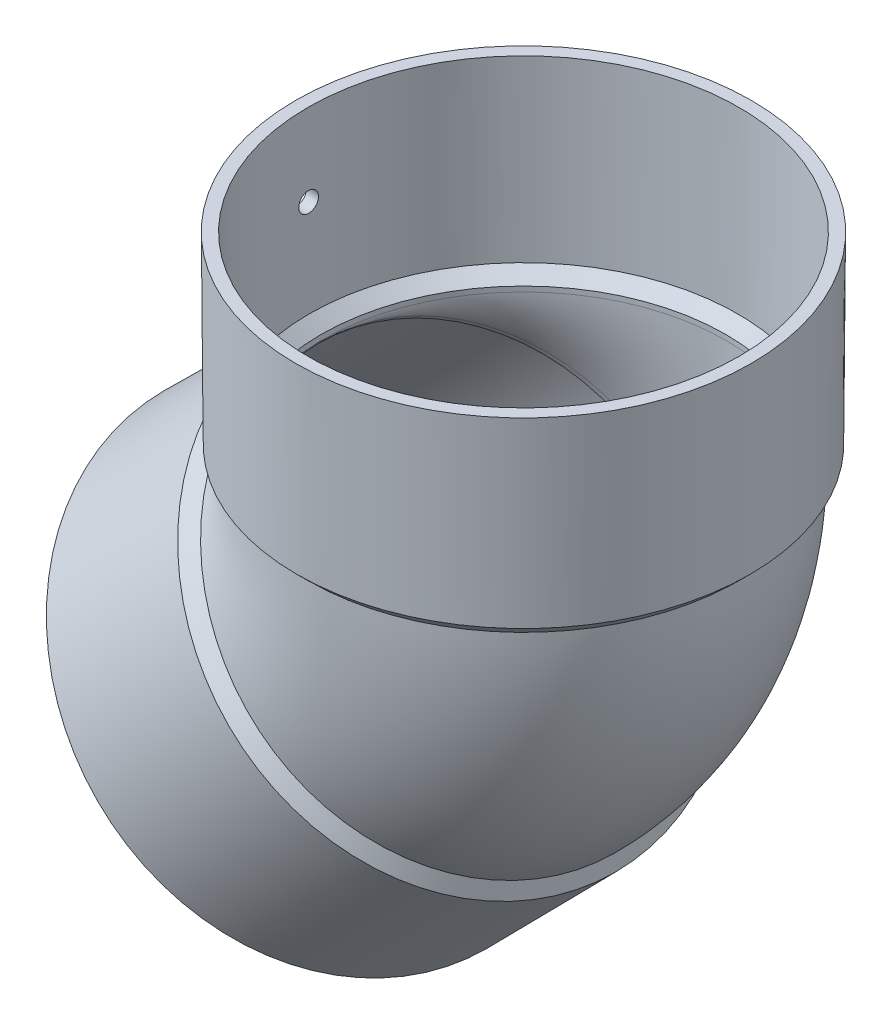
from build123d import *

# Parameters (mm, degrees)
SWEEP1_OUTLINE_R                 = 50.4825
SWEEP1_ANGLE                     = 45
F_10_0_1935_DIAMETER_HOLE1_D     = 4.9149
F_10_0_1935_DIAMETER_HOLE1_DEPTH = 76.2
F_10_0_1935_DIAMETER_HOLE1_TIP   = 1.476584928


# Read off the part's stored shape, not the designer's step: Sweep1
with BuildPart() as part:
    # Sketch1 → Revolve1 (revolve)
    with BuildSketch(Plane.XY):
        Polygon((-11.360023993, -87.422793339), (-9.204762524, -89.578054808), (22.903305281, -57.008000415), (22.873463107, -52.830095994), (20.718201637, -50.674834525), (19.81643184, -51.576604322), (19.846366028, -55.767390512), align=None)
    revolve(axis=Axis((-49.391408666, -49.391408666, 0), (0.707106781186549, 0.707106781186546, 0)))

    # Sketch2 → Revolve2 (revolve)
    with BuildSketch(Plane(origin=(0, 0, 0), x_dir=(-1, 0, 0), z_dir=(0, 0, -1)), mode=Mode.PRIVATE) as revolve2_sk:
        Polygon((-56.505826151, 24.1156612), (-53.5305, 21.182538256), (-50.4825, 21.182538256), (-50.4825, 22.457833333), (-53.467, 25.4), (-53.7845, 69.85), (-56.8325, 69.85), align=None)
    revolve(revolve2_sk.sketch.rotate(Axis((0, 69.85, 0), (0, -1, 0)), 180), axis=Axis((0, 69.85, 0), (0, -1, 0)))

    # Sweep1 outline → Sweep1 (revolve)
    with BuildSketch(Plane(origin=(-51.139171144, 21.182538256, 0), x_dir=(0.7071067811865458, -0.7071067811865492, 0), z_dir=(-0.7071067811865492, -0.7071067811865458, 0))):
        with BuildLine():
            add(Edge.make_bspline(
                [(0, -15.820859805), (3.386630847, -26.767767661), (10.25130148, -38.496554105), (21.767653092, -48.823978651), (37.04613395, -53.530499997), (58.423945129, -53.530500001), (65.508765494, -52.291102822), (71.965878454, -49.951324198), (77.591040871, -46.913712001), (89.454406147, -38.379551501), (96.226005165, -31.333524518), (101.848697911, -22.017553206), (107.472700853, 3.04e-07), (101.848697636, 22.017553663), (96.226004942, 31.333524749), (89.454406032, 38.379551584), (77.591040819, 46.913712039), (71.965878332, 49.951324264), (65.508765283, 52.291102899), (58.42394482, 53.530500055), (37.046133615, 53.530499893), (21.767652893, 48.823978477), (10.2513014, 38.496553967), (3.386630828, 26.767767599), (0, 15.820859805)],
                knots=[7.875906621, 7.875906621, 7.875906621, 7.875906621, 7.875906621, 7.875906621, 9.124748328, 9.124748328, 9.124748328, 9.124748328, 9.770281969, 9.770281969, 9.770281969, 9.770281969, 10.71746965, 10.71746965, 10.71746965, 11.664657316, 11.664657316, 11.664657316, 11.664657316, 12.310190963, 12.310190963, 12.310190963, 12.310190963, 13.559032663, 13.559032663, 13.559032663, 13.559032663, 13.559032663, 13.559032663], degree=5, weights=[1, 1, 0.991757982, 0.985412067, 1, 1, 0.999839694, 1.000222797, 1, 1, 0.999082466, 0.99680945, 1.00319055, 0.99680945, 0.999082467, 1, 1, 1.000222797, 0.999839694, 1, 1, 0.985412067, 0.991757982, 1, 1]))
            Line((0, 15.820859805), (0, -15.820859805))
        make_face()
        with Locations((51.139171144, 0)):
            Circle(SWEEP1_OUTLINE_R, mode=Mode.SUBTRACT)
    revolve(axis=Axis((-51.139171144, 21.182538256, 0), (0, 0, 1)), revolution_arc=SWEEP1_ANGLE)

    # #10 (0.1935) Diameter Hole1
    with Locations(Plane(origin=(-56.686954854, 49.473679541, 0), x_dir=(0.007142674934, -0.999974490772, 0), z_dir=(-0.999974490772, -0.007142674934, 0))):
        with Locations((0, 0)):
            Hole(F_10_0_1935_DIAMETER_HOLE1_D / 2, depth=F_10_0_1935_DIAMETER_HOLE1_DEPTH)
            with Locations((0, 0, -(F_10_0_1935_DIAMETER_HOLE1_DEPTH + F_10_0_1935_DIAMETER_HOLE1_TIP / 2))):  # 118° drill point
                Cone(0, F_10_0_1935_DIAMETER_HOLE1_D / 2, F_10_0_1935_DIAMETER_HOLE1_TIP, mode=Mode.SUBTRACT)


solid = part.part
